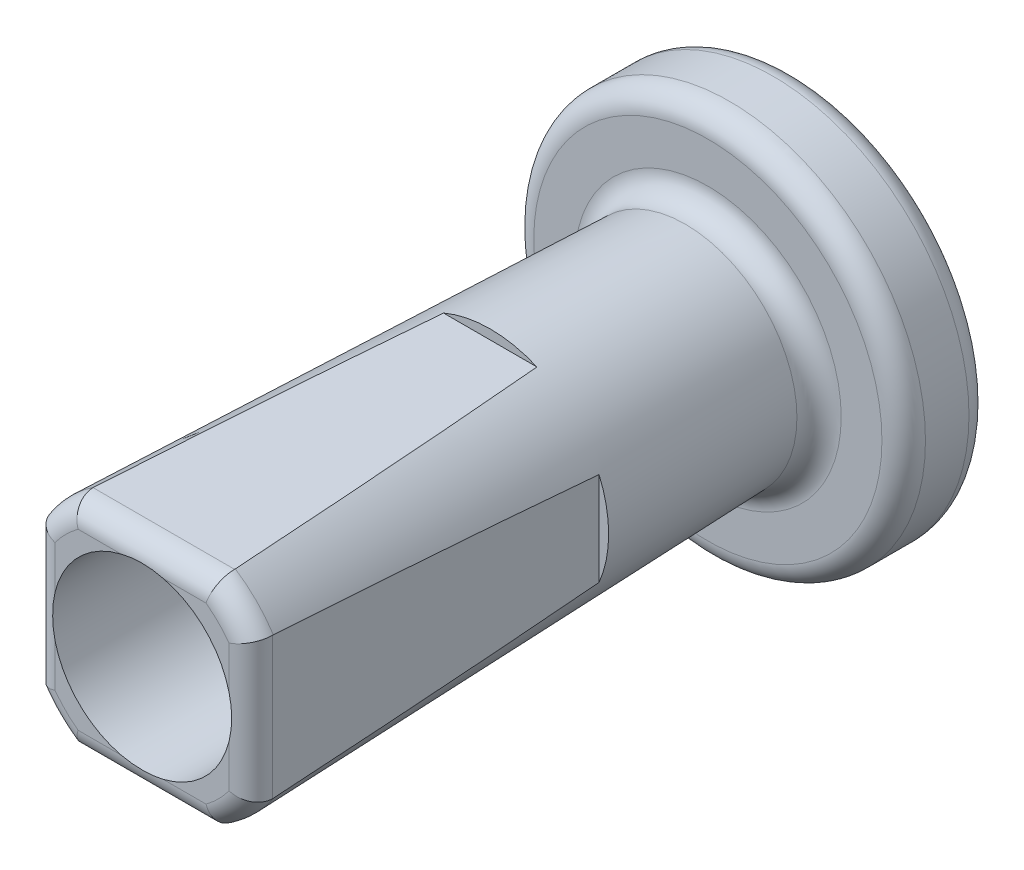
from build123d import *

# Parameters (mm, degrees)
SKETCH_1_R           = 4.5
SKETCH_1_R_2         = 2.057142857
EXTRUDE_1_DEPTH      = 15
SKETCH_2_OUTSIDE_W   = 15.842
SKETCH_2_OUTSIDE_H   = 15.842
SKETCH_2_OUTSIDE_R   = 3
CUT_EXTRUDE_1_DEPTH  = 13
CUT_EXTRUDE_1_DRAFT  = 2
SKETCH_3_OUTSIDE_W   = 14.934
SKETCH_3_OUTSIDE_H   = 14.934
SKETCH_3_OUTSIDE_W_2 = 5
SKETCH_3_OUTSIDE_H_2 = 5
CUT_EXTRUDE_2_DEPTH  = 8
FILLET_2_R           = 0.5
FILLET_3_R           = 0.5
FILLET_4_R           = 0.5
FILLET_5_R           = 0.5


with BuildPart() as part:
    # Эскиз1 → Бобышка-Вытянуть1 (new body)
    with BuildSketch(Plane.XY):
        Circle(SKETCH_1_R)
        Circle(SKETCH_1_R_2, mode=Mode.SUBTRACT)
    extrude(amount=EXTRUDE_1_DEPTH)


with BuildPart() as cut_extrude_1_tool:
    # Эскиз2 outside → Вырез-Вытянуть1 (with draft: the straight prism first)
    with BuildSketch(Plane.XY.offset(15)):
        Rectangle(SKETCH_2_OUTSIDE_W, SKETCH_2_OUTSIDE_H)
        Circle(SKETCH_2_OUTSIDE_R, mode=Mode.SUBTRACT)
    extrude(amount=-CUT_EXTRUDE_1_DEPTH)
    # Вырез-Вытянуть1: the draft: its side faces are tilted about the plane it starts from
    cut_extrude_1_sides = [cut_extrude_1_tool.faces().sort_by_distance(p)[0] for p in [
        (0, -7.921, 8.5),
        (7.921, 0, 8.5),
        (0, 7.921, 8.5),
        (-7.921, 0, 8.5),
        (-3, 0, 8.5),
    ]]
    draft(cut_extrude_1_sides, Plane.XY.offset(15), CUT_EXTRUDE_1_DRAFT)


with BuildPart() as part_1:
    add(part.part)

    # Вырез-Вытянуть1: cut by cut_extrude_1_tool
    add(cut_extrude_1_tool.part, mode=Mode.SUBTRACT)

    # Эскиз3 outside → Вырез-Вытянуть2 (cut)
    with BuildSketch(Plane.XY.offset(15)):
        Rectangle(SKETCH_3_OUTSIDE_W, SKETCH_3_OUTSIDE_H)
        Rectangle(SKETCH_3_OUTSIDE_W_2, SKETCH_3_OUTSIDE_H_2, mode=Mode.SUBTRACT)
    extrude(amount=-CUT_EXTRUDE_2_DEPTH, mode=Mode.SUBTRACT)

    # Скругление2
    # the kernel refuses this fillet: 0.5 mm, written as the material it takes off along each edge
    with BuildSketch(Plane(origin=(0, 0, 15), x_dir=(0.9881342002725989, 0.15359297591892496, 0), z_dir=(0.15359297591892496, -0.9881342002725989, 0))) as fillet_2_piece_1:
        with BuildLine():
            CenterArc((3 - FILLET_2_R * 1.03553031379, -FILLET_2_R), FILLET_2_R, 358, 92)
            Line((3 - FILLET_2_R * 1.03553031379, 0), (3, 0))
            Line((3, 0), (3 - FILLET_2_R * 0.0361394867715, -FILLET_2_R * 1.0348994967))
        make_face()
    revolve(axis=Axis((0, 0, 15), (0, 0, 1)), revolution_arc=72.329594827, mode=Mode.SUBTRACT)
    with BuildSketch(Plane(origin=(0, 0, 15), x_dir=(-0.1535929759189553, 0.9881342002725941, 0), z_dir=(0.9881342002725941, 0.1535929759189553, 0))) as fillet_2_piece_2:
        with BuildLine():
            CenterArc((3 - FILLET_2_R * 1.03553031379, -FILLET_2_R), FILLET_2_R, 358, 92)
            Line((3 - FILLET_2_R * 1.03553031379, 0), (3, 0))
            Line((3, 0), (3 - FILLET_2_R * 0.0361394867715, -FILLET_2_R * 1.0348994967))
        make_face()
    revolve(axis=Axis((0, 0, 15), (0, 0, 1)), revolution_arc=72.329594827, mode=Mode.SUBTRACT)
    with BuildSketch(Plane(origin=(0, 0, 15), x_dir=(-0.9881342002725968, -0.15359297591893833, 0), z_dir=(-0.15359297591893833, 0.9881342002725968, 0))) as fillet_2_piece_3:
        with BuildLine():
            CenterArc((3 - FILLET_2_R * 1.03553031379, -FILLET_2_R), FILLET_2_R, 358, 92)
            Line((3 - FILLET_2_R * 1.03553031379, 0), (3, 0))
            Line((3, 0), (3 - FILLET_2_R * 0.0361394867715, -FILLET_2_R * 1.0348994967))
        make_face()
    revolve(axis=Axis((0, 0, 15), (0, 0, 1)), revolution_arc=72.329594827, mode=Mode.SUBTRACT)
    with BuildSketch(Plane(origin=(0, 0, 15), x_dir=(0.15359297591892515, -0.9881342002725989, 0), z_dir=(-0.9881342002725989, -0.15359297591892515, 0))) as fillet_2_piece_4:
        with BuildLine():
            CenterArc((3 - FILLET_2_R * 1.03553031379, -FILLET_2_R), FILLET_2_R, 358, 92)
            Line((3 - FILLET_2_R * 1.03553031379, 0), (3, 0))
            Line((3, 0), (3 - FILLET_2_R * 0.0361394867715, -FILLET_2_R * 1.0348994967))
        make_face()
    revolve(axis=Axis((0, 0, 15), (0, 0, 1)), revolution_arc=72.329594827, mode=Mode.SUBTRACT)
    with BuildSketch(Plane(origin=(2.5, 2.908312395, 15), x_dir=(-1, 0, 0), z_dir=(0, -1, 0)), Plane(origin=(2.908312395, -2.5, 15), x_dir=(0, 1, 0), z_dir=(-1, 0, 0)), Plane(origin=(-2.5, -2.908312395, 15), x_dir=(1, 0, 0), z_dir=(0, 1, 0)), Plane(origin=(-2.908312395, 2.5, 15), x_dir=(0, -1, 0), z_dir=(1, 0, 0))) as fillet_2_piece_5:
        with BuildLine():
            CenterArc((FILLET_2_R, FILLET_2_R), FILLET_2_R, 180, 90)
            Line((0, FILLET_2_R), (0, 0))
            Line((0, 0), (FILLET_2_R, 0))
        make_face()
    extrude(amount=5.81662479, mode=Mode.SUBTRACT)

    # Скругление3
    fillet_3_edges = [part_1.edges().sort_by_distance(p)[0] for p in [
        (-2.546029997, 0, 2),
    ]]
    fillet(fillet_3_edges, radius=FILLET_3_R)

    # Скругление4
    fillet_4_edges = [part_1.edges().sort_by_distance(p)[0] for p in [
        (-4.5, 0, 2),
    ]]
    fillet(fillet_4_edges, radius=FILLET_4_R)

    # Скругление5
    fillet_5_edges = [part_1.edges().sort_by_distance(p)[0] for p in [
        (-4.5, 0, 0),
    ]]
    fillet(fillet_5_edges, radius=FILLET_5_R)


solid = part_1.part
